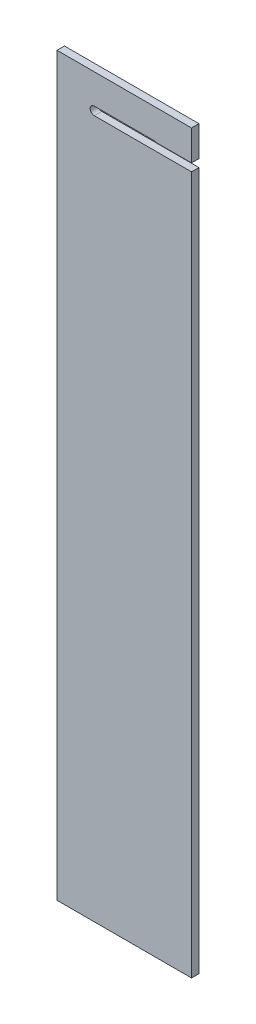
from build123d import *

# Parameters (mm, degrees)
BOSS_EXTRUDE1_DEPTH = 3.175
FILLET1_R           = 3.175


with BuildPart() as part:
    # Sketch1 → Boss-Extrude1 (new body)
    with BuildSketch(Plane.XY):
        with BuildLine():
            Line((-28.75, 165.481), (-28.75, 149.225))
            Line((-28.75, 149.225), (-12.827, 149.225))
            ThreePointArc((-12.827, 149.225), (-14.605, 151.003), (-12.827, 152.781))
            Line((-12.827, 152.781), (12.827, 152.781))
            Line((12.827, 152.781), (12.827, 152.527))
            Line((12.827, 152.527), (28.75, 152.527))
            Line((28.75, 152.527), (28.75, 165.481))
            Line((28.75, 165.481), (-28.75, 165.481))
        make_face()
        Polygon((-12.827, 149.225), (-28.75, 149.225), (-28.75, -149.225), (28.75, -149.225), (28.75, 149.225), align=None)
    extrude(amount=BOSS_EXTRUDE1_DEPTH)

    # Fillet1
    # the kernel refuses this fillet: 3.175 mm, written as the material it takes off along each edge
    with BuildSketch(Plane(origin=(12.827, 152.527, -3.110851973), x_dir=(1, 0, 0), z_dir=(0, 0, 1))) as fillet1_piece_1:
        with BuildLine():
            CenterArc((1.244340789, 3.175), FILLET1_R, 246.926081934, 23.073918066)
            Line((0, 0.254), (-0.024886816, 0.19558))
            ThreePointArc((-0.024886816, 0.19558), (-0.0635, 0.127), (-0.0635, 0))
            Line((-0.0635, 0), (0, -0.0635))
            Line((0, -0.0635), (1.244340789, -0.0635))
            Line((1.244340789, -0.0635), (1.244340789, 0))
        make_face()
    extrude(amount=9.396703947, mode=Mode.SUBTRACT)


solid = part.part
